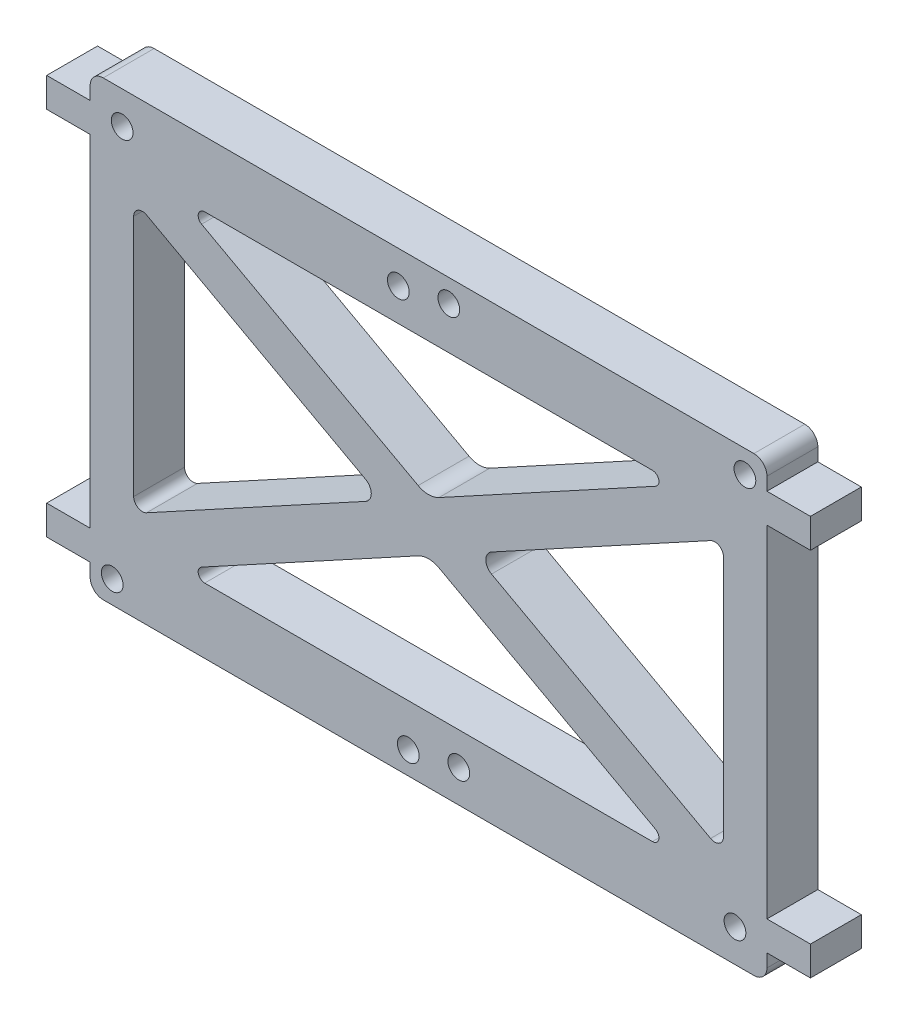
from build123d import *

# Parameters (mm, degrees)
BOSS_EXTRUDE1_DEPTH = 5.85
SKETCH3_R           = 1.25
CUT_EXTRUDE1_DEPTH  = 52.538266366
CUT_EXTRUDE2_DEPTH  = 52.345816772


with BuildPart() as part:
    # Sketch1 → Boss-Extrude1 (new body)
    with BuildSketch(Plane.XY):
        with BuildLine():
            Line((-38.9, 22.98), (-38.9, 24.48))
            ThreePointArc((-38.9, 24.48), (-38.460660172, 25.540660172), (-37.4, 25.98))
            Line((-37.4, 25.98), (37.4, 25.98))
            ThreePointArc((37.4, 25.98), (38.460660172, 25.540660172), (38.9, 24.48))
            Line((38.9, 24.48), (38.9, 22.98))
            Line((38.9, 22.98), (43.9, 22.98))
            Line((43.9, 22.98), (43.9, 19.6))
            Line((43.9, 19.6), (38.9, 19.6))
            Line((38.9, 19.6), (38.9, -19.6))
            Line((38.9, -19.6), (43.9, -19.6))
            Line((43.9, -19.6), (43.9, -22.98))
            Line((43.9, -22.98), (38.9, -22.98))
            Line((38.9, -22.98), (38.9, -24.48))
            ThreePointArc((38.9, -24.48), (38.460660172, -25.540660172), (37.4, -25.98))
            Line((37.4, -25.98), (-37.4, -25.98))
            ThreePointArc((-37.4, -25.98), (-38.460660172, -25.540660172), (-38.9, -24.48))
            Line((-38.9, -24.48), (-38.9, -22.98))
            Line((-38.9, -22.98), (-43.9, -22.98))
            Line((-43.9, -22.98), (-43.9, -19.6))
            Line((-43.9, -19.6), (-38.9, -19.6))
            Line((-38.9, -19.6), (-38.9, 19.6))
            Line((-38.9, 19.6), (-43.9, 19.6))
            Line((-43.9, 19.6), (-43.9, 22.98))
            Line((-43.9, 22.98), (-38.9, 22.98))
        make_face()
    extrude(amount=BOSS_EXTRUDE1_DEPTH)

    # Sketch3 → Cut-Extrude1 (cut, through all)
    with BuildSketch(Plane.XY.offset(7.35)):
        with Locations((-35.225, 22.225)):
            Circle(SKETCH3_R)
        with Locations((-3.475, 22.225)):
            Circle(SKETCH3_R)
        with Locations((-2.332, -23.368)):
            Circle(SKETCH3_R)
        with Locations((-36.368, -23.368)):
            Circle(SKETCH3_R)
        with Locations((2.332, 23.368)):
            Circle(SKETCH3_R)
        with Locations((36.368, 23.368)):
            Circle(SKETCH3_R)
        with Locations((35.225, -22.225)):
            Circle(SKETCH3_R)
        with Locations((3.475, -22.225)):
            Circle(SKETCH3_R)
    extrude(amount=-CUT_EXTRUDE1_DEPTH, mode=Mode.SUBTRACT)

    # Sketch5 → Cut-Extrude2 (cut, through all)
    with BuildSketch(Plane.XY.offset(5.85)):
        with BuildLine():
            Line((25.734036387, -18.48), (-25.734036387, -18.48))
            ThreePointArc((-25.734036387, -18.48), (-26.460804251, -17.915225461), (-26.093012154, -17.071489257))
            Line((-26.093012154, -17.071489257), (-1.196585892, -3.499632109))
            ThreePointArc((-1.196585892, -3.499632109), (0, -3.194667918), (1.196585892, -3.499632109))
            Line((1.196585892, -3.499632109), (26.093012154, -17.071489257))
            ThreePointArc((26.093012154, -17.071489257), (26.460804251, -17.915225461), (25.734036387, -18.48))
        make_face()
        with BuildLine():
            Line((33.9, -13.948599714), (33.9, 13.948599714))
            ThreePointArc((33.9, 13.948599714), (33.410571074, 14.808435267), (32.421365643, 14.826614038))
            Line((32.421365643, 14.826614038), (7.236497737, 1.097517904))
            ThreePointArc((7.236497737, 1.097517904), (6.584790683, 0), (7.236497737, -1.097517904))
            Line((7.236497737, -1.097517904), (32.421365643, -14.826614038))
            ThreePointArc((32.421365643, -14.826614038), (33.410571074, -14.808435267), (33.9, -13.948599714))
        make_face()
        with BuildLine():
            Line((25.734036387, 18.48), (-25.734036387, 18.48))
            ThreePointArc((-25.734036387, 18.48), (-26.460804251, 17.915225461), (-26.093012154, 17.071489257))
            Line((-26.093012154, 17.071489257), (-1.196585892, 3.499632109))
            ThreePointArc((-1.196585892, 3.499632109), (0, 3.194667918), (1.196585892, 3.499632109))
            Line((1.196585892, 3.499632109), (26.093012154, 17.071489257))
            ThreePointArc((26.093012154, 17.071489257), (26.460804251, 17.915225461), (25.734036387, 18.48))
        make_face()
        with BuildLine():
            Line((-33.9, -13.948599714), (-33.9, 13.948599714))
            ThreePointArc((-33.9, 13.948599714), (-33.410571074, 14.808435267), (-32.421365643, 14.826614038))
            Line((-32.421365643, 14.826614038), (-7.236497737, 1.097517904))
            ThreePointArc((-7.236497737, 1.097517904), (-6.584790683, 0), (-7.236497737, -1.097517904))
            Line((-7.236497737, -1.097517904), (-32.421365643, -14.826614038))
            ThreePointArc((-32.421365643, -14.826614038), (-33.410571074, -14.808435267), (-33.9, -13.948599714))
        make_face()
    extrude(amount=-CUT_EXTRUDE2_DEPTH, mode=Mode.SUBTRACT)


solid = part.part
